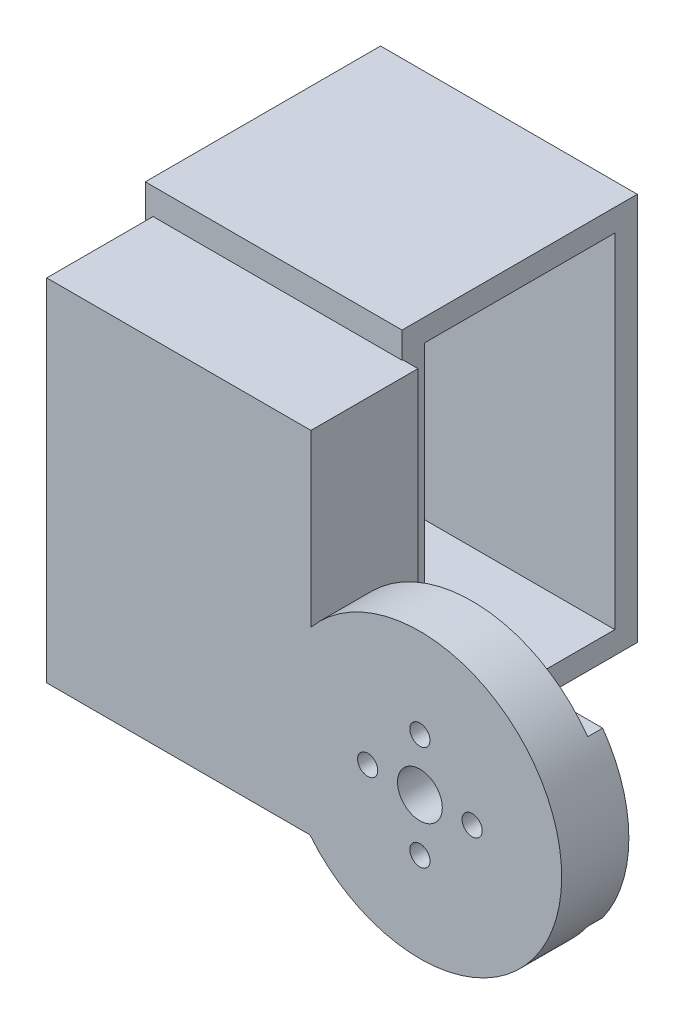
from build123d import *
from build123d.topology import SkipClean

# Parameters (mm, degrees)
S_CYL1_R      = 19
BOSS_1_DEPTH  = 7
BOSS_2_DEPTH  = 2.1
S_BOX3_W      = 28.5
S_BOX3_H      = 10
BOSS_3_DEPTH  = 1.5
S_BOX4_W      = 35.4
S_BOX4_H      = 47
BOSS_4_DEPTH  = 14.34
S_BOX5_W      = 34.4
S_BOX5_H      = 3
BOSS_5_DEPTH  = 31.52
S_BOX6_W      = 34.4
S_BOX6_H      = 3
BOSS_6_DEPTH  = 31.52
S_BOX7_W      = 34.4
S_BOX7_H      = 52.02
BOSS_7_DEPTH  = 3
S_BOX8_W      = 34.4
S_BOX8_H      = 52.02
BOSS_8_DEPTH  = 3
S_BOX9_W      = 2.4
S_BOX9_H      = 52.02
BOSS_9_DEPTH  = 31.52
S_HOLE10_R    = 11
HOLE_10_DEPTH = 2.6
S_HOLE11_R    = 1.1
HOLE_11_DEPTH = 2.6
S_HOLE12_R    = 1.1
HOLE_12_DEPTH = 2.6
S_HOLE13_R    = 1.1
HOLE_13_DEPTH = 2.6
S_HOLE14_R    = 3
HOLE_14_DEPTH = 10.6
S_HOLE15_R    = 1.35
HOLE_15_DEPTH = 10.6
S_HOLE16_R    = 1.35
HOLE_16_DEPTH = 10.6
S_HOLE17_R    = 1.35
HOLE_17_DEPTH = 10.6
S_HOLE18_R    = 1.35
HOLE_18_DEPTH = 10.6
S_HOLE19_R    = 2.3
HOLE_19_DEPTH = 4.5
S_HOLE20_R    = 2.3
HOLE_20_DEPTH = 4.5
S_HOLE21_R    = 2.3
HOLE_21_DEPTH = 4.5
S_HOLE22_R    = 2.3
HOLE_22_DEPTH = 4.5


with BuildPart() as part:
    # S_cyl1 → Boss_1 (new body)
    with BuildSketch(Plane.XY.offset(23)):
        Circle(S_CYL1_R)
    extrude(amount=BOSS_1_DEPTH)

    # S_prism2 → Boss_2 (add)
    with SkipClean():  # the faces are left unmerged after this step: merging them gives an invalid solid
        with BuildSketch(Plane.XY.offset(21)):
            with BuildLine():
                Line((-15.491933385, 11), (15.491933385, 11))
                ThreePointArc((15.491933385, 11), (19, 0), (15.491933385, -11))
                Line((15.491933385, -11), (-15.491933385, -11))
                ThreePointArc((-15.491933385, -11), (-19, 0), (-15.491933385, 11))
            make_face()
        extrude(amount=BOSS_2_DEPTH)

    # S_box3 → Boss_3 (add)
    with SkipClean():  # the faces are left unmerged after this step: merging them gives an invalid solid
        with BuildSketch(Plane.XY.offset(19.6)):
            with Locations((-0.25, 0)):
                Rectangle(S_BOX3_W, S_BOX3_H)
        extrude(amount=BOSS_3_DEPTH)

    # S_box4 → Boss_4 (add)
    with BuildSketch(Plane.XY.offset(15.66)):
        with Locations((-32.3, 11.5)):
            Rectangle(S_BOX4_W, S_BOX4_H)
    extrude(amount=BOSS_4_DEPTH)

    # S_box6 → Boss_6 (add)
    with BuildSketch(Plane.XY.offset(-15.76)):
        with Locations((-33.835, -12.01)):
            Rectangle(S_BOX6_W, S_BOX6_H)
    extrude(amount=BOSS_6_DEPTH)



with BuildPart() as body_2:
    # S_box5 → Boss_5 (new body)
    with BuildSketch(Plane.XY.offset(-15.76)):
        with Locations((-33.835, 37.01)):
            Rectangle(S_BOX5_W, S_BOX5_H)
    extrude(amount=BOSS_5_DEPTH)


with BuildPart() as part_1:
    add(part.part)

    add(body_2.part)  # Boss_7 merges body 2
    # S_box7 → Boss_7 (add)
    with BuildSketch(Plane.XY.offset(-15.76)):
        with Locations((-33.835, 12.5)):
            Rectangle(S_BOX7_W, S_BOX7_H)
    extrude(amount=BOSS_7_DEPTH)

    # S_box8 → Boss_8 (add)
    with BuildSketch(Plane.XY.offset(12.76)):
        with Locations((-33.835, 12.5)):
            Rectangle(S_BOX8_W, S_BOX8_H)
    extrude(amount=BOSS_8_DEPTH)

    # S_box9 → Boss_9 (add)
    with BuildSketch(Plane.XY.offset(-15.76)):
        with Locations((-49.835, 12.5)):
            Rectangle(S_BOX9_W, S_BOX9_H)
    extrude(amount=BOSS_9_DEPTH)

    # S_hole10 → Hole_10 (cut)
    with BuildSketch(Plane(origin=(-51.135, 0, 0), x_dir=(0, 0, -1), z_dir=(1, 0, 0))):
        Circle(S_HOLE10_R)
    extrude(amount=HOLE_10_DEPTH, mode=Mode.SUBTRACT)

    # S_hole11 → Hole_11 (cut)
    with BuildSketch(Plane(origin=(-51.135, 0, 0), x_dir=(0, 0, -1), z_dir=(1, 0, 0))):
        with Locations((-10.25, 8.3)):
            Circle(S_HOLE11_R)
    extrude(amount=HOLE_11_DEPTH, mode=Mode.SUBTRACT)

    # S_hole12 → Hole_12 (cut)
    with BuildSketch(Plane(origin=(-51.135, 0, 0), x_dir=(0, 0, -1), z_dir=(1, 0, 0))):
        with Locations((10.25, 32.75)):
            Circle(S_HOLE12_R)
    extrude(amount=HOLE_12_DEPTH, mode=Mode.SUBTRACT)

    # S_hole13 → Hole_13 (cut)
    with BuildSketch(Plane(origin=(-51.135, 0, 0), x_dir=(0, 0, -1), z_dir=(1, 0, 0))):
        with Locations((-10.25, 32.75)):
            Circle(S_HOLE13_R)
    extrude(amount=HOLE_13_DEPTH, mode=Mode.SUBTRACT)

    # S_hole14 → Hole_14 (cut)
    with BuildSketch(Plane.XY.offset(19.5)):
        Circle(S_HOLE14_R)
    extrude(amount=HOLE_14_DEPTH, mode=Mode.SUBTRACT)

    # S_hole15 → Hole_15 (cut)
    with BuildSketch(Plane.XY.offset(19.5)):
        with Locations((7, 0)):
            Circle(S_HOLE15_R)
    extrude(amount=HOLE_15_DEPTH, mode=Mode.SUBTRACT)

    # S_hole16 → Hole_16 (cut)
    with BuildSketch(Plane.XY.offset(19.5)):
        with Locations((0, -7)):
            Circle(S_HOLE16_R)
    extrude(amount=HOLE_16_DEPTH, mode=Mode.SUBTRACT)

    # S_hole17 → Hole_17 (cut)
    with BuildSketch(Plane.XY.offset(19.5)):
        with Locations((-7, 0)):
            Circle(S_HOLE17_R)
    extrude(amount=HOLE_17_DEPTH, mode=Mode.SUBTRACT)

    # S_hole18 → Hole_18 (cut)
    with BuildSketch(Plane.XY.offset(19.5)):
        with Locations((0, 7)):
            Circle(S_HOLE18_R)
    extrude(amount=HOLE_18_DEPTH, mode=Mode.SUBTRACT)

    # S_hole19 → Hole_19 (cut)
    with BuildSketch(Plane.XY.offset(19.5)):
        with Locations((7, 0)):
            Circle(S_HOLE19_R)
    extrude(amount=HOLE_19_DEPTH, mode=Mode.SUBTRACT)

    # S_hole20 → Hole_20 (cut)
    with BuildSketch(Plane.XY.offset(19.5)):
        with Locations((0, -7)):
            Circle(S_HOLE20_R)
    extrude(amount=HOLE_20_DEPTH, mode=Mode.SUBTRACT)

    # S_hole21 → Hole_21 (cut)
    with BuildSketch(Plane.XY.offset(19.5)):
        with Locations((-7, 0)):
            Circle(S_HOLE21_R)
    extrude(amount=HOLE_21_DEPTH, mode=Mode.SUBTRACT)

    # S_hole22 → Hole_22 (cut)
    with BuildSketch(Plane.XY.offset(19.5)):
        with Locations((0, 7)):
            Circle(S_HOLE22_R)
    extrude(amount=HOLE_22_DEPTH, mode=Mode.SUBTRACT)


solid = part_1.part
